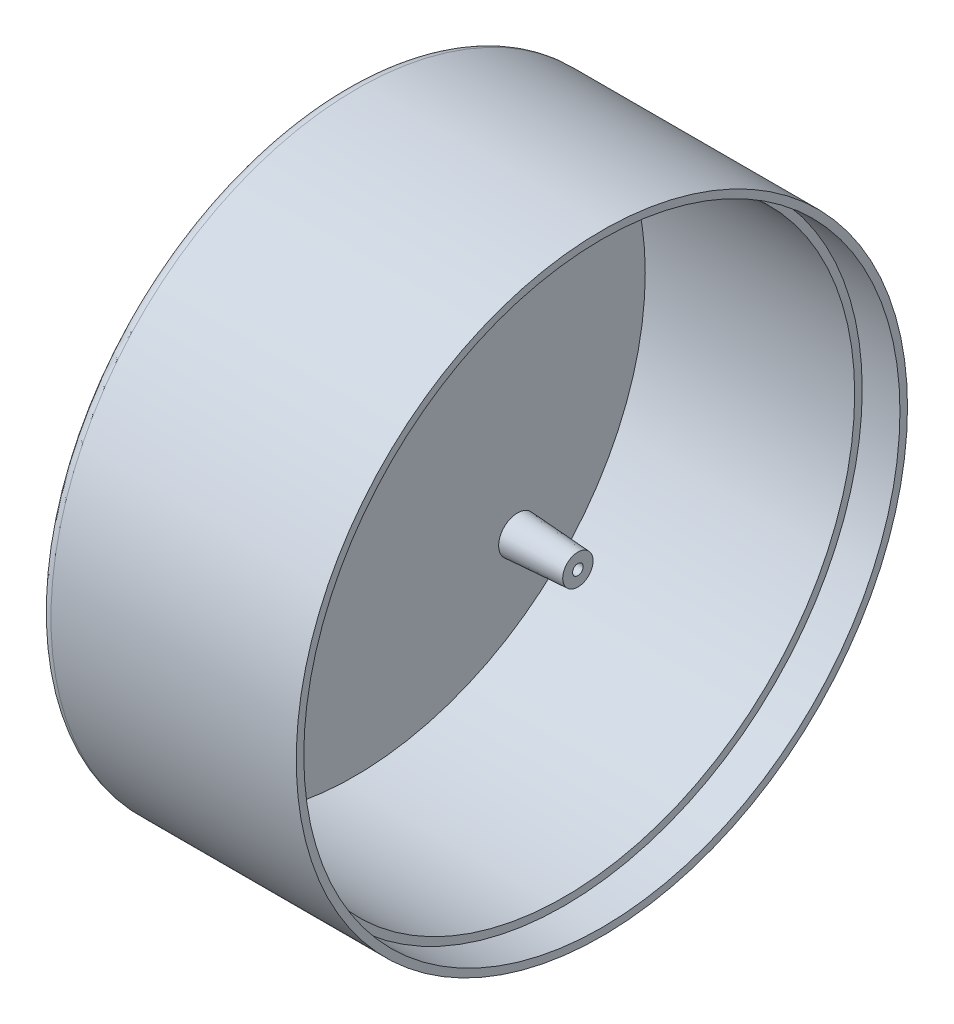
from build123d import *

# Parameters (mm, degrees)
SKETCH1_R                     = 81
BOSS_EXTRUDE1_DEPTH           = 2.5
SKETCH2_R                     = 81
SKETCH2_R_2                   = 77
BOSS_EXTRUDE2_DEPTH           = 65.5
SKETCH4_R                     = 5
BOSS_EXTRUDE3_DEPTH           = 16
BOSS_EXTRUDE3_DRAFT           = 3.5
BOSS_EXTRUDE3_PROFILE_2_DEPTH = 16
BOSS_EXTRUDE3_PROFILE_2_DRAFT = 3.5
BOSS_EXTRUDE3_PROFILE_3_DEPTH = 16
BOSS_EXTRUDE3_PROFILE_3_DRAFT = 3.5
BOSS_EXTRUDE3_PROFILE_4_DEPTH = 16
BOSS_EXTRUDE3_PROFILE_4_DRAFT = 3.5
SKETCH6_R                     = 1.4
CUT_EXTRUDE2_DEPTH            = 7
SKETCH7_R                     = 79
CUT_EXTRUDE3_DEPTH            = 10
FILLET1_R                     = 3


with BuildPart() as part:
    # Sketch1 → Boss-Extrude1 (new body)
    with BuildSketch(Plane(origin=(0, 0, 0), x_dir=(0, 0, -1), z_dir=(1, 0, 0))):
        Circle(SKETCH1_R)
    extrude(amount=BOSS_EXTRUDE1_DEPTH)

    # Sketch2 → Boss-Extrude2 (add)
    with BuildSketch(Plane(origin=(2.5, 0, 0), x_dir=(0, 0, -1), z_dir=(1, 0, 0))):
        Circle(SKETCH2_R)
        Circle(SKETCH2_R_2, mode=Mode.SUBTRACT)
    extrude(amount=BOSS_EXTRUDE2_DEPTH)


with BuildPart() as boss_extrude3_tool:
    # Sketch4 → Boss-Extrude3 (with draft: the straight prism first)
    with BuildSketch(Plane(origin=(2.5, 0, 0), x_dir=(0, 0, -1), z_dir=(1, 0, 0))):
        with Locations((43.14, 43.135)):
            Circle(SKETCH4_R)
    extrude(amount=BOSS_EXTRUDE3_DEPTH)
    # Boss-Extrude3: the draft: its side faces are tilted about the plane it starts from
    boss_extrude3_sides = [boss_extrude3_tool.faces().sort_by_distance(p)[0] for p in [
        (10.5, 43.135, -38.14),
    ]]
    draft(boss_extrude3_sides, Plane(origin=(2.5, 0, 0), x_dir=(0, 0, -1), z_dir=(1, 0, 0)), BOSS_EXTRUDE3_DRAFT)


with BuildPart() as part_1:
    add(part.part)

    # Boss-Extrude3: add boss_extrude3_tool
    add(boss_extrude3_tool.part)


with BuildPart() as boss_extrude3_profile_2_tool:
    # Sketch4 → Boss-Extrude3 profile 2 (with draft: the straight prism first)
    with BuildSketch(Plane(origin=(2.5, 0, 0), x_dir=(0, 0, -1), z_dir=(1, 0, 0))):
        with Locations((-43.14, 43.135)):
            Circle(SKETCH4_R)
    extrude(amount=BOSS_EXTRUDE3_PROFILE_2_DEPTH)
    # Boss-Extrude3 profile 2: the draft: its side faces are tilted about the plane it starts from
    boss_extrude3_profile_2_sides = [boss_extrude3_profile_2_tool.faces().sort_by_distance(p)[0] for p in [
        (10.5, 43.135, 48.14),
    ]]
    draft(boss_extrude3_profile_2_sides, Plane(origin=(2.5, 0, 0), x_dir=(0, 0, -1), z_dir=(1, 0, 0)), BOSS_EXTRUDE3_PROFILE_2_DRAFT)


with BuildPart() as part_2:
    add(part_1.part)

    # Boss-Extrude3 profile 2: add boss_extrude3_profile_2_tool
    add(boss_extrude3_profile_2_tool.part)


with BuildPart() as boss_extrude3_profile_3_tool:
    # Sketch4 → Boss-Extrude3 profile 3 (with draft: the straight prism first)
    with BuildSketch(Plane(origin=(2.5, 0, 0), x_dir=(0, 0, -1), z_dir=(1, 0, 0))):
        with Locations((43.14, -43.135)):
            Circle(SKETCH4_R)
    extrude(amount=BOSS_EXTRUDE3_PROFILE_3_DEPTH)
    # Boss-Extrude3 profile 3: the draft: its side faces are tilted about the plane it starts from
    boss_extrude3_profile_3_sides = [boss_extrude3_profile_3_tool.faces().sort_by_distance(p)[0] for p in [
        (10.5, -43.135, -38.14),
    ]]
    draft(boss_extrude3_profile_3_sides, Plane(origin=(2.5, 0, 0), x_dir=(0, 0, -1), z_dir=(1, 0, 0)), BOSS_EXTRUDE3_PROFILE_3_DRAFT)


with BuildPart() as part_3:
    add(part_2.part)

    # Boss-Extrude3 profile 3: add boss_extrude3_profile_3_tool
    add(boss_extrude3_profile_3_tool.part)


with BuildPart() as boss_extrude3_profile_4_tool:
    # Sketch4 → Boss-Extrude3 profile 4 (with draft: the straight prism first)
    with BuildSketch(Plane(origin=(2.5, 0, 0), x_dir=(0, 0, -1), z_dir=(1, 0, 0))):
        with Locations((-43.14, -43.135)):
            Circle(SKETCH4_R)
    extrude(amount=BOSS_EXTRUDE3_PROFILE_4_DEPTH)
    # Boss-Extrude3 profile 4: the draft: its side faces are tilted about the plane it starts from
    boss_extrude3_profile_4_sides = [boss_extrude3_profile_4_tool.faces().sort_by_distance(p)[0] for p in [
        (10.5, -43.135, 48.14),
    ]]
    draft(boss_extrude3_profile_4_sides, Plane(origin=(2.5, 0, 0), x_dir=(0, 0, -1), z_dir=(1, 0, 0)), BOSS_EXTRUDE3_PROFILE_4_DRAFT)


with BuildPart() as part_4:
    add(part_3.part)

    # Boss-Extrude3 profile 4: add boss_extrude3_profile_4_tool
    add(boss_extrude3_profile_4_tool.part)

    # Sketch6 → Cut-Extrude2 (cut)
    with BuildSketch(Plane(origin=(18.5, 0, 0), x_dir=(0, 0, -1), z_dir=(1, 0, 0))):
        with Locations((-43.14, 43.135)):
            Circle(SKETCH6_R)
        with Locations((43.14, 43.135)):
            Circle(SKETCH6_R)
        with Locations((-43.14, -43.135)):
            Circle(SKETCH6_R)
        with Locations((43.14, -43.135)):
            Circle(SKETCH6_R)
    extrude(amount=-CUT_EXTRUDE2_DEPTH, mode=Mode.SUBTRACT)

    # Sketch7 → Cut-Extrude3 (cut)
    with BuildSketch(Plane(origin=(68, 0, 0), x_dir=(0, 0, -1), z_dir=(1, 0, 0))):
        Circle(SKETCH7_R)
    extrude(amount=-CUT_EXTRUDE3_DEPTH, mode=Mode.SUBTRACT)

    # Fillet1
    fillet1_edges = [part_4.edges().sort_by_distance(p)[0] for p in [
        (0, 0, 81),
    ]]
    fillet(fillet1_edges, radius=FILLET1_R)


solid = part_4.part
